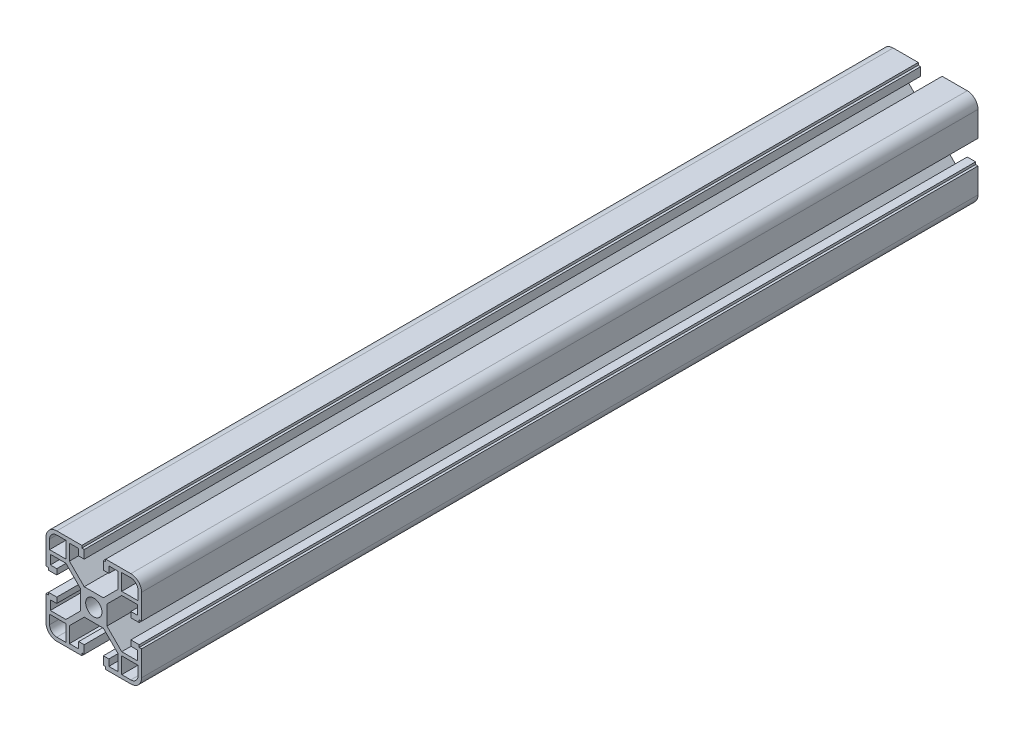
from build123d import *
from build123d.topology import SkipClean

# Parameters (mm, degrees)
BOSS_EXTRUDE1_DEPTH  = 350
MIRROR3_COPY_1_DEPTH = 350
MIRROR3_COPY_2_DEPTH = 350


with BuildPart() as part:
    # Sketch1 → Boss-Extrude1 (new body)
    with BuildSketch(Plane.XY):
        with BuildLine():
            Line((3.4, 0), (5.5, 0))
            Line((5.5, 0), (5.5, 4))
            Line((5.5, 4), (11.69, 10.19))
            Line((11.69, 10.19), (18.2, 10.19))
            Line((18.2, 10.19), (18.2, 6.3))
            Line((18.2, 6.3), (15.5, 6.3))
            Line((15.5, 6.3), (15.5, 4))
            Line((15.5, 4), (19, 4))
            Line((19, 4), (19, 5))
            Line((19, 5), (20, 5))
            Line((20, 5), (20, 15.5))
            ThreePointArc((20, 15.5), (18.681980515, 18.681980515), (15.5, 20))
            Line((15.5, 20), (5, 20))
            Line((5, 20), (5, 19))
            Line((5, 19), (4, 19))
            Line((4, 19), (4, 15.5))
            Line((4, 15.5), (6.3, 15.5))
            Line((6.3, 15.5), (6.3, 18.2))
            Line((6.3, 18.2), (10.19, 18.2))
            Line((10.19, 18.2), (10.19, 11.69))
            Line((10.19, 11.69), (4, 5.5))
            Line((4, 5.5), (0, 5.5))
            Line((0, 5.5), (0, 3.4))
            ThreePointArc((0, 3.4), (2.404163056, 2.404163056), (3.4, 0))
        make_face()
        with BuildLine():
            Line((18.5, 11.69), (18.5, 15.5))
            ThreePointArc((18.5, 15.5), (17.621320344, 17.621320344), (15.5, 18.5))
            Line((15.5, 18.5), (11.69, 18.5))
            Line((11.69, 18.5), (11.69, 11.69))
            Line((11.69, 11.69), (18.5, 11.69))
        make_face(mode=Mode.SUBTRACT)
    boss_extrude1 = extrude(amount=BOSS_EXTRUDE1_DEPTH)

    # Mirror1: Boss-Extrude1 across plane
    add(boss_extrude1.mirror(Plane.ZX))

    # Mirror2: Boss-Extrude1 across plane
    add(boss_extrude1.mirror(Plane(origin=(0, 0, 0), x_dir=(0, 0, 1), z_dir=(1, 0, 0))))

    # Mirror3 copy 1 sketch → Mirror3 copy 1 (add)
    with BuildSketch(Plane(origin=(0, 0, 0), x_dir=(-1, 0, 0), z_dir=(0, 0, 1))):
        with BuildLine():
            Line((3.4, 0), (5.5, 0))
            Line((5.5, 0), (5.5, 4))
            Line((5.5, 4), (11.69, 10.19))
            Line((11.69, 10.19), (18.2, 10.19))
            Line((18.2, 10.19), (18.2, 6.3))
            Line((18.2, 6.3), (15.5, 6.3))
            Line((15.5, 6.3), (15.5, 4))
            Line((15.5, 4), (19, 4))
            Line((19, 4), (19, 5))
            Line((19, 5), (20, 5))
            Line((20, 5), (20, 15.5))
            ThreePointArc((20, 15.5), (18.681980515, 18.681980515), (15.5, 20))
            Line((15.5, 20), (5, 20))
            Line((5, 20), (5, 19))
            Line((5, 19), (4, 19))
            Line((4, 19), (4, 15.5))
            Line((4, 15.5), (6.3, 15.5))
            Line((6.3, 15.5), (6.3, 18.2))
            Line((6.3, 18.2), (10.19, 18.2))
            Line((10.19, 18.2), (10.19, 11.69))
            Line((10.19, 11.69), (4, 5.5))
            Line((4, 5.5), (0, 5.5))
            Line((0, 5.5), (0, 3.4))
            ThreePointArc((0, 3.4), (2.404163056, 2.404163056), (3.4, 0))
        make_face()
        with BuildLine():
            Line((18.5, 11.69), (18.5, 15.5))
            ThreePointArc((18.5, 15.5), (17.621320344, 17.621320344), (15.5, 18.5))
            Line((15.5, 18.5), (11.69, 18.5))
            Line((11.69, 18.5), (11.69, 11.69))
            Line((11.69, 11.69), (18.5, 11.69))
        make_face(mode=Mode.SUBTRACT)
    extrude(amount=MIRROR3_COPY_1_DEPTH)

    # Mirror3 copy 2 sketch → Mirror3 copy 2 (add)
    with SkipClean():  # the faces are left unmerged after this step: merging them gives an invalid solid
        with BuildSketch(Plane.XY):
            with BuildLine():
                Line((3.4, 0), (5.5, 0))
                Line((5.5, 0), (5.5, -4))
                Line((5.5, -4), (11.69, -10.19))
                Line((11.69, -10.19), (18.2, -10.19))
                Line((18.2, -10.19), (18.2, -6.3))
                Line((18.2, -6.3), (15.5, -6.3))
                Line((15.5, -6.3), (15.5, -4))
                Line((15.5, -4), (19, -4))
                Line((19, -4), (19, -5))
                Line((19, -5), (20, -5))
                Line((20, -5), (20, -15.5))
                ThreePointArc((20, -15.5), (18.681980515, -18.681980515), (15.5, -20))
                Line((15.5, -20), (5, -20))
                Line((5, -20), (5, -19))
                Line((5, -19), (4, -19))
                Line((4, -19), (4, -15.5))
                Line((4, -15.5), (6.3, -15.5))
                Line((6.3, -15.5), (6.3, -18.2))
                Line((6.3, -18.2), (10.19, -18.2))
                Line((10.19, -18.2), (10.19, -11.69))
                Line((10.19, -11.69), (4, -5.5))
                Line((4, -5.5), (0, -5.5))
                Line((0, -5.5), (0, -3.4))
                ThreePointArc((0, -3.4), (2.404163056, -2.404163056), (3.4, 0))
            make_face()
            with BuildLine():
                Line((18.5, -11.69), (18.5, -15.5))
                ThreePointArc((18.5, -15.5), (17.621320344, -17.621320344), (15.5, -18.5))
                Line((15.5, -18.5), (11.69, -18.5))
                Line((11.69, -18.5), (11.69, -11.69))
                Line((11.69, -11.69), (18.5, -11.69))
            make_face(mode=Mode.SUBTRACT)
        extrude(amount=MIRROR3_COPY_2_DEPTH)


solid = part.part
